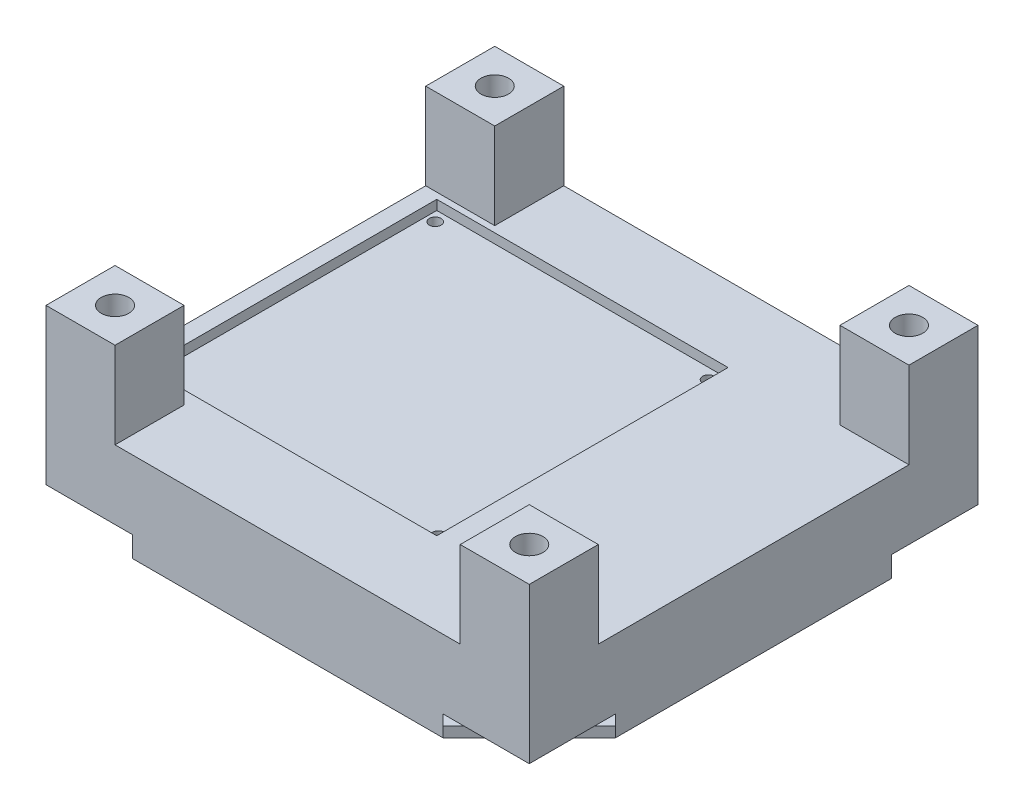
from build123d import *

# Parameters (mm, degrees)
SKETCH2_W                = 177.8
SKETCH2_H                = 165.1
BOSS_EXTRUDE1_DEPTH      = 25.4
SKETCH6_W                = 25.4
SKETCH6_H                = 25.4
BOSS_EXTRUDE2_DEPTH      = 31.75
MIRROR2_COPY_1_SKETCH_W  = 25.4
MIRROR2_COPY_1_SKETCH_H  = 25.4
MIRROR2_COPY_1_DEPTH     = 31.75
MIRROR2_COPY_2_SKETCH_W  = 25.4
MIRROR2_COPY_2_SKETCH_H  = 25.4
MIRROR2_COPY_2_DEPTH     = 31.75
SKETCH9_W                = 107.188
SKETCH9_H                = 107.188
CUT_EXTRUDE3_DEPTH       = 3.556
SKETCH10_RX              = 2.159
SKETCH10_RY              = 2.159
CUT_EXTRUDE4_DEPTH       = 20.32
MIRROR4_COPY_1_SKETCH_RX = 2.159
MIRROR4_COPY_1_SKETCH_RY = 2.159
MIRROR4_COPY_1_DEPTH     = 20.32
MIRROR4_COPY_2_SKETCH_RX = 2.159
MIRROR4_COPY_2_SKETCH_RY = 2.159
MIRROR4_COPY_2_DEPTH     = 20.32
SKETCH14_R               = 5.08
CUT_EXTRUDE5_DEPTH       = 20.32
MIRROR6_COPY_1_SKETCH_R  = 5.08
MIRROR6_COPY_1_DEPTH     = 20.32
MIRROR6_COPY_2_SKETCH_R  = 5.08
MIRROR6_COPY_2_DEPTH     = 20.32
BOSS_EXTRUDE3_DEPTH      = 7.62
SKETCH16_W               = 44.901280606
SKETCH16_H               = 3.81
CUT_EXTRUDE6_DEPTH       = 187.96
SKETCH17_W               = 44.901280606
SKETCH17_H               = 3.81
CUT_EXTRUDE7_DEPTH       = 187.96
SKETCH19_W               = 44.901280606
SKETCH19_H               = 3.81
CUT_EXTRUDE8_DEPTH       = 187.96
SKETCH20_W               = 44.901280606
SKETCH20_H               = 3.81
CUT_EXTRUDE9_DEPTH       = 187.96


with BuildPart() as part:
    # Sketch2 → Boss-Extrude1 (new body)
    with BuildSketch(Plane(origin=(0, 0, 0), x_dir=(1, 0, 0), z_dir=(0, 1, 0))):
        with Locations((88.9, -82.55)):
            Rectangle(SKETCH2_W, SKETCH2_H)
    extrude(amount=BOSS_EXTRUDE1_DEPTH)

    # Sketch6 → Boss-Extrude2 (add)
    with BuildSketch(Plane(origin=(0, 25.4, 0), x_dir=(1, 0, 0), z_dir=(0, 1, 0))):
        with Locations((12.7, -12.7)):
            Rectangle(SKETCH6_W, SKETCH6_H)
    boss_extrude2 = extrude(amount=BOSS_EXTRUDE2_DEPTH)

    # Mirror1: Boss-Extrude2 across plane
    add(boss_extrude2.mirror(Plane(origin=(0, 0, 82.55), x_dir=(1, 0, 0), z_dir=(0, 0, -1))))

    # Mirror2 copy 1 sketch → Mirror2 copy 1 (add)
    with BuildSketch(Plane(origin=(177.8, 25.4, 165.1), x_dir=(-1, 0, 0), z_dir=(0, 1, 0))):
        with Locations((12.7, -12.7)):
            Rectangle(MIRROR2_COPY_1_SKETCH_W, MIRROR2_COPY_1_SKETCH_H)
    extrude(amount=MIRROR2_COPY_1_DEPTH)

    # Mirror2 copy 2 sketch → Mirror2 copy 2 (add)
    with BuildSketch(Plane(origin=(177.8, 25.4, 0), x_dir=(-1, 0, 0), z_dir=(0, 1, 0))):
        with Locations((12.7, 12.7)):
            Rectangle(MIRROR2_COPY_2_SKETCH_W, MIRROR2_COPY_2_SKETCH_H)
    extrude(amount=MIRROR2_COPY_2_DEPTH)

    # Sketch9 → Cut-Extrude3 (cut)
    with BuildSketch(Plane(origin=(0, 25.4, 0), x_dir=(1, 0, 0), z_dir=(0, 1, 0))):
        with Locations((59.944, -81.276983136)):
            Rectangle(SKETCH9_W, SKETCH9_H)
    extrude(amount=-CUT_EXTRUDE3_DEPTH, mode=Mode.SUBTRACT)

    # Sketch10 → Cut-Extrude4 (cut)
    with BuildSketch(Plane(origin=(0, 21.844, 0), x_dir=(1, 0, 0), z_dir=(0, 1, 0))):
        with Locations(Location((9.662951288, -31.573935809), (0, 0, 56.28607255))):
            Ellipse(SKETCH10_RX, SKETCH10_RY)
    cut_extrude4 = extrude(amount=-CUT_EXTRUDE4_DEPTH, mode=Mode.SUBTRACT)

    # Mirror3: Cut-Extrude4 across plane
    add(cut_extrude4.mirror(Plane.XY.offset(81.276983136)), mode=Mode.SUBTRACT)

    # Mirror4 copy 1 sketch → Mirror4 copy 1 (cut)
    with BuildSketch(Plane(origin=(119.888, 21.844, 162.553966273), x_dir=(-1, 0, 0), z_dir=(0, 1, 0))):
        with Locations(Location((9.662951288, -31.573935809), (0, 0, 56.28607255))):
            Ellipse(MIRROR4_COPY_1_SKETCH_RX, MIRROR4_COPY_1_SKETCH_RY)
    extrude(amount=-MIRROR4_COPY_1_DEPTH, mode=Mode.SUBTRACT)

    # Mirror4 copy 2 sketch → Mirror4 copy 2 (cut)
    with BuildSketch(Plane(origin=(119.888, 21.844, 0), x_dir=(-1, 0, 0), z_dir=(0, 1, 0))):
        with Locations(Location((9.662951288, 31.573935809), (0, 0, -56.28607255))):
            Ellipse(MIRROR4_COPY_2_SKETCH_RX, MIRROR4_COPY_2_SKETCH_RY)
    extrude(amount=-MIRROR4_COPY_2_DEPTH, mode=Mode.SUBTRACT)

    # Sketch14 → Cut-Extrude5 (cut)
    with BuildSketch(Plane(origin=(0, 57.15, 0), x_dir=(1, 0, 0), z_dir=(0, 1, 0))):
        with Locations((12.7, -12.7)):
            Circle(SKETCH14_R)
    cut_extrude5 = extrude(amount=-CUT_EXTRUDE5_DEPTH, mode=Mode.SUBTRACT)

    # Mirror5: Cut-Extrude5 across plane
    add(cut_extrude5.mirror(Plane.ZY.offset(-88.9)), mode=Mode.SUBTRACT)

    # Mirror6 copy 1 sketch → Mirror6 copy 1 (cut)
    with BuildSketch(Plane(origin=(177.8, 57.15, 165.1), x_dir=(-1, 0, 0), z_dir=(0, 1, 0))):
        with Locations((12.7, -12.7)):
            Circle(MIRROR6_COPY_1_SKETCH_R)
    extrude(amount=-MIRROR6_COPY_1_DEPTH, mode=Mode.SUBTRACT)

    # Mirror6 copy 2 sketch → Mirror6 copy 2 (cut)
    with BuildSketch(Plane(origin=(0, 57.15, 165.1), x_dir=(1, 0, 0), z_dir=(0, 1, 0))):
        with Locations((12.7, 12.7)):
            Circle(MIRROR6_COPY_2_SKETCH_R)
    extrude(amount=-MIRROR6_COPY_2_DEPTH, mode=Mode.SUBTRACT)

    # Sketch15 → Boss-Extrude3 (add)
    with BuildSketch(Plane(origin=(0, 0, 0), x_dir=(-1, 0, 0), z_dir=(0, -1, 0))):
        Polygon((-146.05, 0), (-31.75, 0), (0, -31.75), (0, -133.35), (-31.75, -165.1), (-146.05, -165.1), (-177.8, -133.35), (-177.8, -31.75), align=None)
    extrude(amount=BOSS_EXTRUDE3_DEPTH)

    # Sketch16 → Cut-Extrude6 (cut)
    with BuildSketch(Plane(origin=(15.875, 0, 15.875), x_dir=(-0.7071067811865476, 0, 0.7071067811865476), z_dir=(-0.7071067811865476, 0, -0.7071067811865476))):
        with Locations((0, -1.905)):
            Rectangle(SKETCH16_W, SKETCH16_H)
    extrude(amount=-CUT_EXTRUDE6_DEPTH, mode=Mode.SUBTRACT)

    # Sketch17 → Cut-Extrude7 (cut)
    with BuildSketch(Plane(origin=(155.575, 0, 155.575), x_dir=(0.7071067811865472, 0, -0.7071067811865479), z_dir=(0.7071067811865479, 0, 0.7071067811865472))):
        with Locations((8.980256121, -1.905)):
            Rectangle(SKETCH17_W, SKETCH17_H)
    extrude(amount=-CUT_EXTRUDE7_DEPTH, mode=Mode.SUBTRACT)

    # Sketch19 → Cut-Extrude8 (cut)
    with BuildSketch(Plane(origin=(-66.675, 0, 66.675), x_dir=(0.7071067811865472, 0, 0.7071067811865479), z_dir=(-0.7071067811865479, 0, 0.7071067811865472))):
        with Locations((116.743329574, -1.905)):
            Rectangle(SKETCH19_W, SKETCH19_H)
    extrude(amount=-CUT_EXTRUDE8_DEPTH, mode=Mode.SUBTRACT)

    # Sketch20 → Cut-Extrude9 (cut)
    with BuildSketch(Plane(origin=(73.025, 0, -73.025), x_dir=(-0.7071067811865475, 0, -0.7071067811865476), z_dir=(0.7071067811865476, 0, -0.7071067811865475))):
        with Locations((-125.723585695, -1.905)):
            Rectangle(SKETCH20_W, SKETCH20_H)
    extrude(amount=-CUT_EXTRUDE9_DEPTH, mode=Mode.SUBTRACT)


solid = part.part
